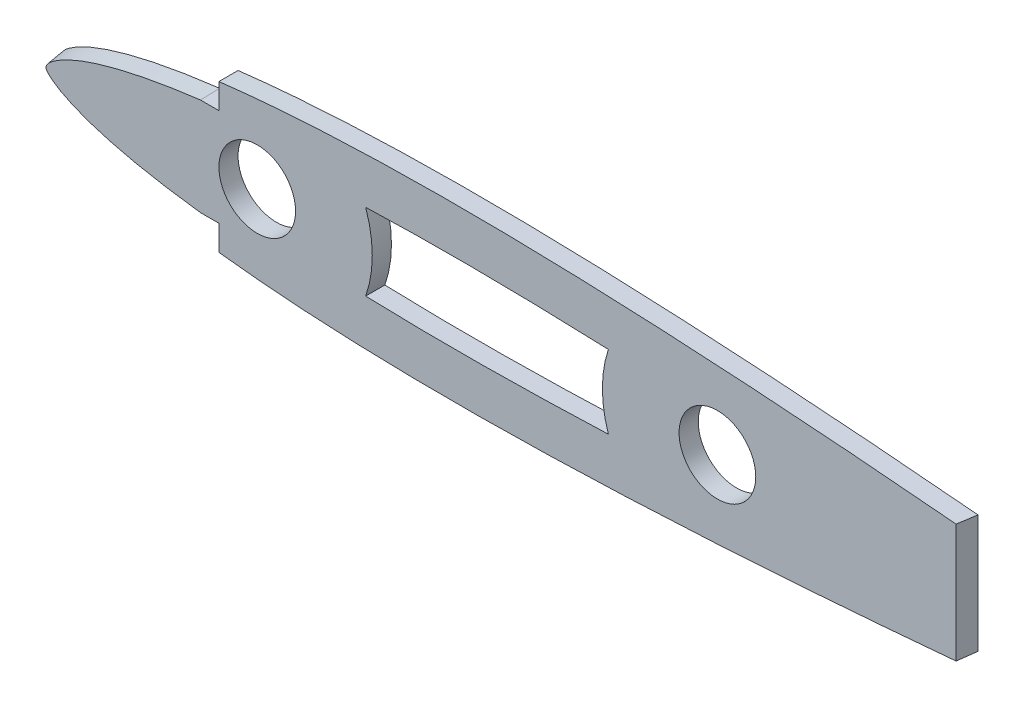
from build123d import *

# Parameters (mm, degrees)
BOSS_EXTRUDE1_DEPTH     = 3.175
SKETCH2_R               = 6.35
CUT_EXTRUDE1_DEPTH      = 3.175
CUT_EXTRUDE2_DEPTH      = 238.638124498
CUT_EXTRUDE2_DEPTH_BACK = 238.638124498
CUT_EXTRUDE3_DEPTH      = 7.62


with BuildPart() as part:
    # Sketch1 → Boss-Extrude1 (new body)
    with BuildSketch(Plane.XY):
        with BuildLine():
            add(Edge.make_bspline(
                [(237.0836, 0.298725336), (236.995594177, 0.372475408), (236.426976915, 0.302841036), (235.414414738, 0.587878253), (233.557510406, 0.764057302), (231.055978259, 1.142159154), (227.833630131, 1.564095564), (223.947681725, 2.084112793), (219.408243114, 2.671942868), (214.248186401, 3.326415443), (208.497669056, 4.03606524), (202.192664292, 4.791288168), (195.371926847, 5.582717259), (188.077459081, 6.399577403), (180.354259346, 7.2318954), (172.249998357, 8.069333754), (163.814621862, 8.901083193), (155.10015976, 9.715468455), (146.160279484, 10.50179834), (137.050196099, 11.246926821), (127.825887085, 11.938704549), (118.544307176, 12.564288117), (109.262643889, 13.110597113), (100.038037253, 13.563829729), (90.927458146, 13.911900095), (81.986813488, 14.143452851), (73.27135464, 14.247178081), (64.83463449, 14.214844108), (56.728667619, 14.040205364), (49.003349951, 13.718834947), (41.706232299, 13.249892202), (34.882163012, 12.634788148), (28.572900537, 11.878326773), (22.816901851, 10.986944444), (17.649046914, 9.969950888), (13.099625234, 8.838845522), (9.194488598, 7.604658034), (5.953477664, 6.278883166), (3.386928106, 4.870490409), (1.49878923, 3.376700029), (0.289451642, 1.761373844), (-0.134894757, 0), (0.289451642, -1.761373844), (1.49878923, -3.376700029), (3.386928106, -4.870490409), (5.953477664, -6.278883166), (9.194488598, -7.604658034), (13.099625234, -8.838845522), (17.649046914, -9.969950888), (22.816901851, -10.986944444), (28.572900537, -11.878326773), (34.882163012, -12.634788148), (41.706232299, -13.249892202), (49.003349951, -13.718834947), (56.728667619, -14.040205364), (64.83463449, -14.214844108), (73.27135464, -14.247178081), (81.986813488, -14.143452851), (90.927458146, -13.911900095), (100.038037253, -13.563829729), (109.262643889, -13.110597113), (118.544307176, -12.564288117), (127.825887085, -11.938704549), (137.050196099, -11.246926821), (146.160279484, -10.50179834), (155.10015976, -9.715468455), (163.814621862, -8.901083193), (172.249998357, -8.069333754), (180.354259346, -7.2318954), (188.077459081, -6.399577403), (195.371926847, -5.582717259), (202.192664292, -4.791288168), (208.497669056, -4.03606524), (214.248186401, -3.326415443), (219.408243114, -2.671942868), (223.947681725, -2.084112793), (227.833630131, -1.564095564), (231.055978259, -1.142159154), (233.557510406, -0.764057302), (235.414414738, -0.587878253), (236.426976915, -0.302841036), (237.226122795, -0.400706552), (237.226122795, 0.179289302), (237.0836, 0.298725336)],
                knots=[0, 0, 0, 0, 0.000762215, 0.003044706, 0.006832246, 0.012101176, 0.018817536, 0.026939455, 0.036414848, 0.047184629, 0.059180413, 0.072327874, 0.086544061, 0.10174058, 0.117823336, 0.134691452, 0.152240154, 0.17036129, 0.188941008, 0.207865435, 0.227016078, 0.246275696, 0.265524943, 0.284644966, 0.303520118, 0.322034575, 0.340078353, 0.357542593, 0.374325482, 0.390329891, 0.40546389, 0.419643801, 0.432793371, 0.444843817, 0.455737921, 0.465428653, 0.47388632, 0.481101634, 0.487101684, 0.491975368, 0.495930678, 0.499382808, 0.502834938, 0.506790248, 0.511663932, 0.517663982, 0.524879296, 0.533336963, 0.543027695, 0.553921799, 0.565972245, 0.579121815, 0.593301726, 0.608435725, 0.624440134, 0.641223023, 0.658687263, 0.676731041, 0.695245498, 0.71412065, 0.733240673, 0.75248992, 0.771749538, 0.790900181, 0.809824608, 0.828404326, 0.846525462, 0.864074164, 0.88094228, 0.897025036, 0.912221555, 0.926437743, 0.939585203, 0.951580988, 0.962350768, 0.971826161, 0.979948081, 0.98666444, 0.991933371, 0.99572091, 0.998003402, 0.998765616, 1, 1, 1, 1], degree=3))
        make_face()
    extrude(amount=BOSS_EXTRUDE1_DEPTH)

    # Sketch2 → Cut-Extrude1 (cut)
    with BuildSketch(Plane.XY.offset(3.175)):
        with Locations((38.1, 0)):
            Circle(SKETCH2_R)
        with Locations((114.3, 0)):
            Circle(SKETCH2_R)
    extrude(amount=-CUT_EXTRUDE1_DEPTH, mode=Mode.SUBTRACT)

    # Sketch3 → Cut-Extrude2 (cut, two sides: drawn at the far end of the back side and taken through both)
    with BuildSketch(Plane(origin=(0, 0, 0), x_dir=(1, 0, 0), z_dir=(0, 1, 0)).offset(-CUT_EXTRUDE2_DEPTH_BACK)):
        Polygon((154.274292451, 0), (153.827643764, -3.175), (237.190492096, -3.175), (237.190492096, 0), align=None)
    extrude(amount=CUT_EXTRUDE2_DEPTH + CUT_EXTRUDE2_DEPTH_BACK, mode=Mode.SUBTRACT)

    # Sketch6 → Cut-Loft1 section 0
    with BuildSketch(Plane.XY.offset(3.175)):
        with BuildLine():
            Line((31.75, 8.076408981), (31.75, 11.683250037))
            Line((31.75, 11.683250037), (31.75, 18.395885889))
            Line((31.75, 18.395885889), (-8.998418256, 14.186873402))
            Line((-8.998418256, 14.186873402), (-8.032236021, -19.061162304))
            Line((-8.032236021, -19.061162304), (31.75, -17.664488176))
            Line((31.75, -17.664488176), (31.75, -11.683250037))
            Line((31.75, -11.683250037), (31.75, -8.076408982))
            Line((31.75, -8.076408982), (28.702, -8.076408982))
            add(Edge.make_bspline(
                [(28.702, 8.076408981), (28.062019842, 7.997428017), (26.781360323, 7.83190678), (24.863238423, 7.559576486), (22.952864289, 7.261817641), (21.053229662, 6.936585888), (19.16878625, 6.582266966), (17.301352642, 6.194891801), (15.452394184, 5.770523851), (13.933846318, 5.382610192), (12.734807014, 5.049324169), (11.845778194, 4.787008043), (10.968295358, 4.511299981), (10.104114856, 4.221132537), (9.254625692, 3.915388001), (8.425053114, 3.594578064), (7.620756036, 3.259288164), (6.846465326, 2.908873288), (6.109521351, 2.54404498), (5.415085904, 2.161886878), (4.771732283, 1.761162286), (4.200618093, 1.360175223), (3.806381168, 1.039757171), (3.546177048, 0.785599694), (3.383920596, 0.598121849), (3.254767765, 0.412598836), (3.174243399, 0.254294099), (3.130379566, 0.1138318), (3.117983008, 3.16e-07), (3.130380113, -0.113832551), (3.174242347, -0.254293127), (3.254769825, -0.41260053), (3.383916396, -0.598118576), (3.546175023, -0.785598191), (3.806491944, -1.039841143), (4.20055318, -1.360126113), (4.77176705, -1.761188423), (5.41506381, -2.161870561), (6.109540545, -2.544058683), (6.846443726, -2.908858743), (7.620785984, -3.259307593), (8.424980153, -3.594531648), (9.25458748, -3.915363972), (10.104136109, -4.221145998), (10.968310445, -4.511309444), (11.845765894, -4.787000103), (12.734797781, -5.049319704), (13.933888924, -5.382621972), (15.4523656, -5.770516248), (17.301363518, -6.194894525), (19.168788744, -6.582267832), (21.053210036, -6.936580559), (22.952903047, -7.261827785), (24.863140664, -7.559551063), (26.781311277, -7.831894211), (28.062019842, -7.997428017), (28.702, -8.076408982)],
                knots=[0, 0, 0, 0, 0.03125, 0.0625, 0.09375, 0.125, 0.15625, 0.1875, 0.21875, 0.25, 0.265625, 0.28125, 0.296875, 0.3125, 0.328125, 0.34375, 0.359375, 0.375, 0.390625, 0.40625, 0.421875, 0.4375, 0.453125, 0.4609375, 0.46875, 0.4765625, 0.484375, 0.4921875, 0.5, 0.5078125, 0.515625, 0.5234375, 0.53125, 0.5390625, 0.546875, 0.5625, 0.578125, 0.59375, 0.609375, 0.625, 0.640625, 0.65625, 0.671875, 0.6875, 0.703125, 0.71875, 0.734375, 0.75, 0.78125, 0.8125, 0.84375, 0.875, 0.90625, 0.9375, 0.96875, 1, 1, 1, 1], degree=3))
            Line((28.702, 8.076408981), (31.75, 8.076408981))
        make_face()
    # Sketch5 → Cut-Loft1 section 1
    with BuildSketch(Plane(origin=(0, 0, 0), x_dir=(-1, 0, 0), z_dir=(0, 0, -1))):
        with BuildLine():
            Line((-31.75, -11.773629767), (-31.75, -8.172962021))
            Line((-31.75, -8.172962021), (-28.702, -8.172962021))
            add(Edge.make_bspline(
                [(-28.702, 8.17296202), (-28.04991232, 8.094156153), (-26.745045473, 7.928885379), (-24.790625464, 7.656596528), (-22.843952156, 7.358509388), (-20.907993005, 7.032534185), (-18.987137813, 6.677003012), (-17.083250909, 6.287895965), (-15.197789513, 5.861217163), (-13.648800631, 5.470809812), (-12.425346674, 5.135128731), (-11.518003122, 4.870795331), (-10.622183079, 4.592820857), (-9.739660488, 4.300116815), (-8.871825969, 3.991542258), (-8.023884998, 3.667528855), (-7.201182529, 3.328585226), (-6.408478992, 2.973975846), (-5.653156453, 2.604323149), (-4.940474095, 2.216549268), (-4.279203879, 1.809302193), (-3.690786556, 1.400484278), (-3.283034517, 1.072052932), (-3.013354261, 0.810752852), (-2.845020129, 0.61774711), (-2.710958875, 0.426579544), (-2.627372313, 0.263337315), (-2.58177414, 0.117962243), (-2.568858472, 3.28e-07), (-2.581774708, -0.117963026), (-2.627371214, -0.263336298), (-2.710961028, -0.426581314), (-2.845015751, -0.617743699), (-3.01335214, -0.810751279), (-3.283150094, -1.072140545), (-3.690718878, -1.400433069), (-4.27924005, -1.809329397), (-4.940451244, -2.216532371), (-5.653176086, -2.604337198), (-6.408457303, -2.973961207), (-7.201212263, -3.32860454), (-8.023812968, -3.667483017), (-8.871788374, -3.991518624), (-9.739681391, -4.300130053), (-10.622197985, -4.592830206), (-11.517990976, -4.870787488), (-12.425337452, -5.135124325), (-13.648844495, -5.470821714), (-15.197759965, -5.861209465), (-17.083262354, -6.287898751), (-18.987139884, -6.677003815), (-20.907973868, -7.032528958), (-22.843990245, -7.358519372), (-24.790529171, -7.656571477), (-26.744997097, -7.928872987), (-28.04991232, -8.094156153), (-28.702, -8.172962021)],
                knots=[0, 0, 0, 0, 0.03125, 0.0625, 0.09375, 0.125, 0.15625, 0.1875, 0.21875, 0.25, 0.265625, 0.28125, 0.296875, 0.3125, 0.328125, 0.34375, 0.359375, 0.375, 0.390625, 0.40625, 0.421875, 0.4375, 0.453125, 0.4609375, 0.46875, 0.4765625, 0.484375, 0.4921875, 0.5, 0.5078125, 0.515625, 0.5234375, 0.53125, 0.5390625, 0.546875, 0.5625, 0.578125, 0.59375, 0.609375, 0.625, 0.640625, 0.65625, 0.671875, 0.6875, 0.703125, 0.71875, 0.734375, 0.75, 0.78125, 0.8125, 0.84375, 0.875, 0.90625, 0.9375, 0.96875, 1, 1, 1, 1], degree=3))
            Line((-28.702, 8.17296202), (-31.75, 8.17296202))
            Line((-31.75, 8.17296202), (-31.75, 11.773629767))
            Line((-31.75, 11.773629767), (-31.75, 14.858712547))
            Line((-31.75, 14.858712547), (1.815959964, 11.773629767))
            Line((1.815959964, 11.773629767), (0.454850161, -12.744594259))
            Line((0.454850161, -12.744594259), (-31.75, -15.902369002))
            Line((-31.75, -15.902369002), (-31.75, -11.773629767))
        make_face()
    loft(mode=Mode.SUBTRACT)

    # Sketch7 → Cut-Extrude3 (cut)
    with BuildSketch(Plane.XY.offset(3.175)):
        with BuildLine():
            ThreePointArc((56.054224621, -6.367756139), (57.15, 0), (56.054224621, 6.367756139))
            add(Edge.make_bspline(
                [(96.245779506, 6.07845559), (93.861405197, 6.172308422), (91.477846396, 6.255305153), (84.344598798, 6.468290826), (79.598726683, 6.562324228), (70.121487659, 6.629056545), (65.389943722, 6.602176751), (59.131701158, 6.462519155), (57.592019112, 6.419793098), (56.054224621, 6.367756139)],
                knots=[0.437309704, 0.437309704, 0.437309704, 0.437309704, 0.5, 0.5, 0.625, 0.625, 0.75, 0.75, 0.790835922, 0.790835922, 0.790835922, 0.790835922], degree=3))
            ThreePointArc((96.245779506, 6.07845559), (95.25, 0), (96.245779506, -6.07845559))
            add(Edge.make_bspline(
                [(56.054224621, -6.367756139), (57.592019112, -6.419793098), (59.131701158, -6.462519155), (65.389943722, -6.602176751), (70.121487659, -6.629056545), (79.598726683, -6.562324228), (84.344598798, -6.468290826), (91.477846396, -6.255305153), (93.861405197, -6.172308422), (96.245779506, -6.07845559)],
                knots=[0.209164078, 0.209164078, 0.209164078, 0.209164078, 0.25, 0.25, 0.375, 0.375, 0.5, 0.5, 0.562690296, 0.562690296, 0.562690296, 0.562690296], degree=3))
        make_face()
    extrude(amount=-CUT_EXTRUDE3_DEPTH, mode=Mode.SUBTRACT)


solid = part.part
